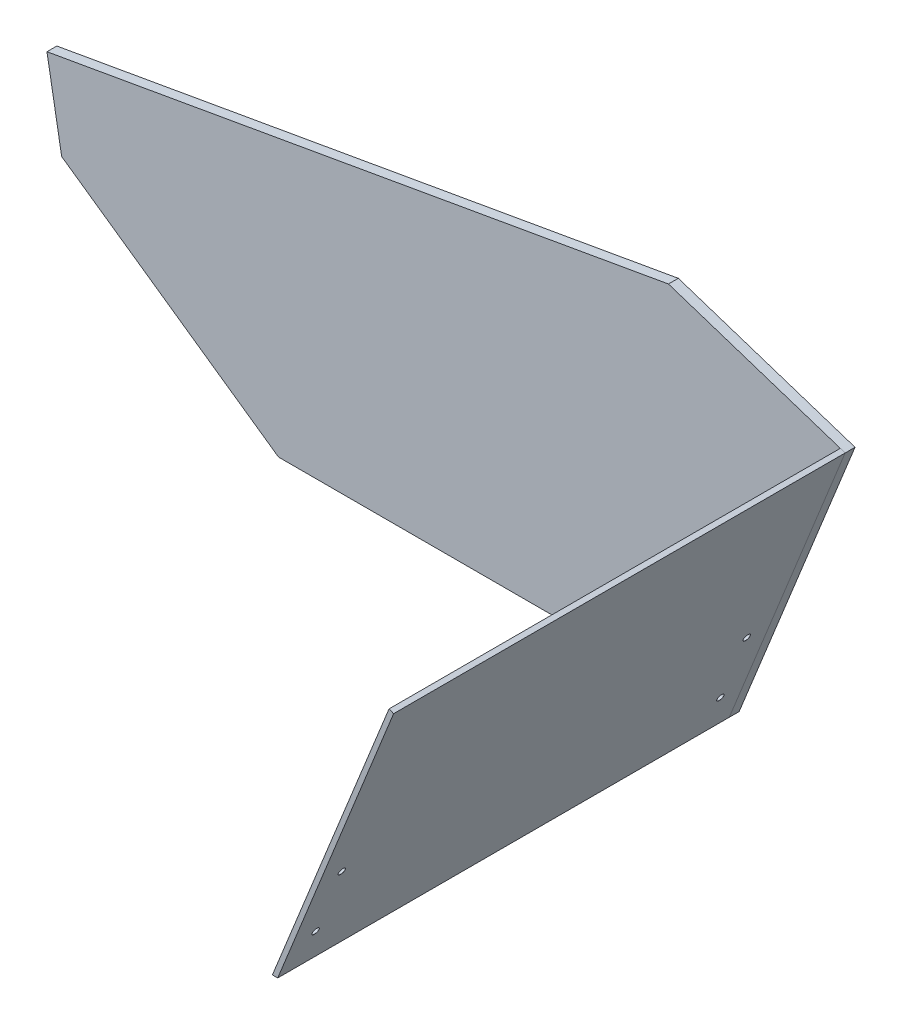
from build123d import *

# Parameters (mm, degrees)
BOSS_EXTRUDE1_DEPTH           = 290
BOSS_EXTRUDE2_DEPTH           = 6.35
M4_CLEARANCE_HOLE1_AT_2_COUNT = 2
M4_CLEARANCE_HOLE1_AT_2_PITCH = 45
M4_CLEARANCE_HOLE1_AT_3_COUNT = 2
M4_CLEARANCE_HOLE1_AT_3_PITCH = 260
M4_CLEARANCE_HOLE1_AT_4_COUNT = 2
M4_CLEARANCE_HOLE1_AT_4_PITCH = 263.865496039


with BuildPart() as part:
    # Sketch1 → Boss-Extrude1 (new body)
    with BuildSketch(Plane.XY):
        Polygon((140, 0), (143.424347808, 0), (217.865127421, 184.247394979), (214.921318683, 185.436770913), align=None)
    extrude(amount=BOSS_EXTRUDE1_DEPTH)

    # Sketch4 → M4 Clearance Hole1 (revolve, cut)
    with BuildSketch(Plane(origin=(169.646809347, 64.90286982, 275), x_dir=(0.3746065934159096, 0.9271838545667884, 0), z_dir=(0, 0, 1))):
        Polygon((0, 0), (0, 489.265093346), (2.25, 489.265093346), (2.25, 0.025), (2.275, 0), align=None)
    m4_clearance_hole1 = revolve(axis=Axis((175.534426824, 62.524117951, 275), (-0.9271838545667884, 0.3746065934159096, 0)), mode=Mode.SUBTRACT)

    # M4 Clearance Hole1 at 2: M4 Clearance Hole1 ×2
    with Locations(*[Vector(-0.3746065934159096, -0.9271838545667884, 0) * (i * M4_CLEARANCE_HOLE1_AT_2_PITCH) for i in range(1, M4_CLEARANCE_HOLE1_AT_2_COUNT)]):
        add(m4_clearance_hole1, mode=Mode.SUBTRACT)

    # M4 Clearance Hole1 at 3: M4 Clearance Hole1 ×2
    with Locations(*[(0, 0, -i * M4_CLEARANCE_HOLE1_AT_3_PITCH) for i in range(1, M4_CLEARANCE_HOLE1_AT_3_COUNT)]):
        add(m4_clearance_hole1, mode=Mode.SUBTRACT)

    # M4 Clearance Hole1 at 4: M4 Clearance Hole1 ×2
    with Locations(*[Vector(-0.06388594551675915, -0.15812326386660155, -0.9853505058554559) * (i * M4_CLEARANCE_HOLE1_AT_4_PITCH) for i in range(1, M4_CLEARANCE_HOLE1_AT_4_COUNT)]):
        add(m4_clearance_hole1, mode=Mode.SUBTRACT)


with BuildPart() as body_2:
    # Sketch2 → Boss-Extrude2 (new body)
    with BuildSketch(Plane.XY):
        Polygon((-294.777867348, 151.108031048), (104.369939009, 221.488558599), (217.865127421, 184.247394979), (143.424347808, 0), (-146.070887152, 0), (-285.326734681, 97.50799418), align=None)
    extrude(amount=-BOSS_EXTRUDE2_DEPTH)


solid = Compound([part.part, body_2.part])
